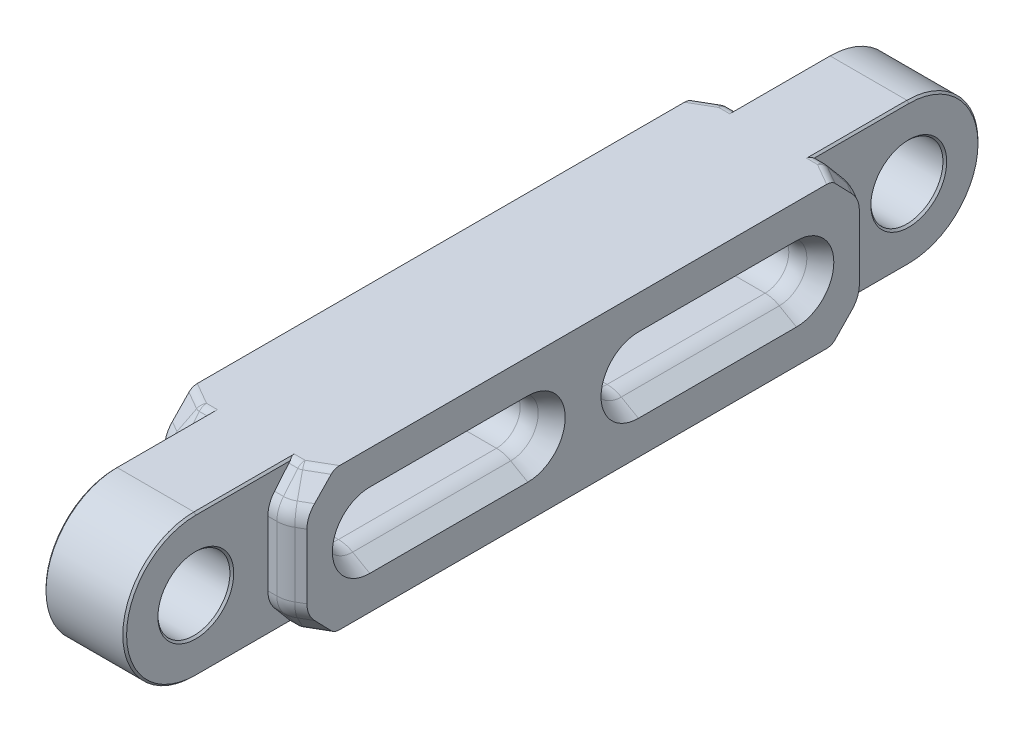
from build123d import *
from OCP.BRepFilletAPI import BRepFilletAPI_MakeChamfer

# Parameters (mm, degrees)
BOSS_EXTRUDE1_DEPTH = 8.5
BOSS_EXTRUDE2_DEPTH = 15
CHAMFER8_SIZE       = 3
CHAMFER8_SIZE2      = 1.732050808
FILLET6_R           = 6
CHAMFER9_SIZE       = 6
CHAMFER9_SIZE2      = 5.034597787
FILLET7_R           = 6
CHAMFER10_SIZE      = 5
CHAMFER10_SIZE2     = 2.886751346
FILLET8_R           = 6
FILLET9_R           = 2
CHAMFER11_SIZE      = 0.4


with BuildPart() as part:
    # Sketch1 → Boss-Extrude1 (new body)
    with BuildSketch(Plane.YZ):
        with BuildLine():
            ThreePointArc((0, -7.6), (-7.6, 0), (0, 7.6))
            Line((0, 7.6), (0, 15))
            ThreePointArc((0, 15), (-10.606601718, 10.606601718), (-15, 0))
            Line((-15, 0), (-15, -75.2))
            Line((-15, -75.2), (0, -75.2))
            Line((0, -75.2), (0, -68.533333333))
            ThreePointArc((0, -68.533333333), (-3.535533906, -67.068867239), (-5, -63.533333333))
            Line((-5, -63.533333333), (-5, -30.2))
            ThreePointArc((-5, -30.2), (-3.535533906, -26.664466094), (0, -25.2))
            Line((0, -25.2), (0, -7.6))
        make_face()
    extrude(amount=BOSS_EXTRUDE1_DEPTH)

    # Sketch1<4> → Boss-Extrude2 (add)
    with BuildSketch(Plane.YZ):
        with BuildLine():
            Line((0, -15.2), (-15, -15.2))
            Line((-15, -15.2), (-15, -75.2))
            Line((-15, -75.2), (0, -75.2))
            Line((0, -75.2), (0, -68.533333333))
            ThreePointArc((0, -68.533333333), (-3.535533906, -67.068867239), (-5, -63.533333333))
            Line((-5, -63.533333333), (-5, -30.2))
            ThreePointArc((-5, -30.2), (-3.535533906, -26.664466094), (0, -25.2))
            Line((0, -25.2), (0, -15.2))
        make_face()
    extrude(amount=BOSS_EXTRUDE2_DEPTH)

    # Chamfer8
    chamfer8_edges = [part.edges().sort_by_distance(p)[0] for p in [
        (15, -7.5, -15.2),
    ]]
    chamfer8_side = [part.faces().sort_by_distance(p)[0] for p in [
        (11.75, -7.5, -15.2),
    ]]
    chamfer(chamfer8_edges, length=CHAMFER8_SIZE, length2=CHAMFER8_SIZE2, reference=chamfer8_side[0])

    # Fillet6
    fillet6_edges = [part.edges().sort_by_distance(p)[0] for p in [
        (12, -7.5, -15.2),
    ]]
    fillet(fillet6_edges, radius=FILLET6_R)

    # Chamfer9: one chamfer whose edges measure the first distance from different faces: ONE call of the kernel's chamfer builder (chamfer() names one face for all edges)
    chamfer9_edges_1 = [part.edges().sort_by_distance(p)[0] for p in [
        (14.196152423, -15, -16.467949192),
    ]]
    chamfer9_side_1 = [part.faces().sort_by_distance(p)[0] for p in [
        (14.196152423, -7.5, -16.467949192),
    ]]
    chamfer9_edges_2 = [part.edges().sort_by_distance(p)[0] for p in [
        (11.945219116, -15, -15.404445042),
    ]]
    chamfer9_side_2 = [part.faces().sort_by_distance(p)[0] for p in [
        (11.945219116, -7.5, -15.404445042),
    ]]
    chamfer9_edges_3 = [part.edges().sort_by_distance(p)[0] for p in [
        (9.446152423, -15, -15.2),
    ]]
    chamfer9_side_3 = [part.faces().sort_by_distance(p)[0] for p in [
        (9.446152423, -7.5, -15.2),
    ]]
    chamfer9 = BRepFilletAPI_MakeChamfer(part.part.solid().wrapped)
    for e in chamfer9_edges_1:
        chamfer9.Add(CHAMFER9_SIZE, CHAMFER9_SIZE2, e.wrapped, chamfer9_side_1[0].wrapped)  # the first distance lies on this face
    for e in chamfer9_edges_2:
        chamfer9.Add(CHAMFER9_SIZE, CHAMFER9_SIZE2, e.wrapped, chamfer9_side_2[0].wrapped)  # the first distance lies on this face
    for e in chamfer9_edges_3:
        chamfer9.Add(CHAMFER9_SIZE, CHAMFER9_SIZE2, e.wrapped, chamfer9_side_3[0].wrapped)  # the first distance lies on this face
    add(Compound.cast(chamfer9.Shape()), mode=Mode.REPLACE)

    # Fillet7
    fillet7_edges = [part.edges().sort_by_distance(p)[0] for p in [
        (14.196152423, -9, -16.467949192),
        (11.945219116, -9, -15.404445042),
        (9.446152423, -9, -15.2),
    ]]
    fillet(fillet7_edges, radius=FILLET7_R)

    # Chamfer10: one chamfer whose edges measure the first distance from different faces: ONE call of the kernel's chamfer builder (chamfer() names one face for all edges)
    chamfer10_edges_1 = [part.edges().sort_by_distance(p)[0] for p in [
        (15, -3.535533906, -67.068867239),
    ]]
    chamfer10_side_1 = [part.faces().sort_by_distance(p)[0] for p in [
        (7.5, -3.535533906, -67.068867239),
    ]]
    chamfer10_edges_2 = [part.edges().sort_by_distance(p)[0] for p in [
        (15, -5, -46.866666667),
    ]]
    chamfer10_side_2 = [part.faces().sort_by_distance(p)[0] for p in [
        (7.5, -5, -46.866666667),
    ]]
    chamfer10_edges_3 = [part.edges().sort_by_distance(p)[0] for p in [
        (15, -3.535533906, -26.664466094),
    ]]
    chamfer10_side_3 = [part.faces().sort_by_distance(p)[0] for p in [
        (7.5, -3.535533906, -26.664466094),
    ]]
    chamfer10 = BRepFilletAPI_MakeChamfer(part.part.solid().wrapped)
    for e in chamfer10_edges_1:
        chamfer10.Add(CHAMFER10_SIZE, CHAMFER10_SIZE2, e.wrapped, chamfer10_side_1[0].wrapped)  # the first distance lies on this face
    for e in chamfer10_edges_2:
        chamfer10.Add(CHAMFER10_SIZE, CHAMFER10_SIZE2, e.wrapped, chamfer10_side_2[0].wrapped)  # the first distance lies on this face
    for e in chamfer10_edges_3:
        chamfer10.Add(CHAMFER10_SIZE, CHAMFER10_SIZE2, e.wrapped, chamfer10_side_3[0].wrapped)  # the first distance lies on this face
    add(Compound.cast(chamfer10.Shape()), mode=Mode.REPLACE)

    # Fillet8
    fillet8_edges = [part.edges().sort_by_distance(p)[0] for p in [
        (10, -3.535533906, -67.068867239),
        (10, -5, -46.866666667),
        (10, -3.535533906, -26.664466094),
    ]]
    fillet(fillet8_edges, radius=FILLET8_R)

    # Fillet9
    fillet9_edges = [part.edges().sort_by_distance(p)[0] for p in [
        (9.446152423, -15, -20.234597787),
        (10.642169324, -15, -20.26749307),
        (12.937502976, -15, -21.554720371),
    ]]
    fillet(fillet9_edges, radius=FILLET9_R)

    # Chamfer11
    chamfer11_edges = [part.edges().sort_by_distance(p)[0] for p in [
        (8.5, -7.6, 0),
        (8.5, -15, -10.583606552),
        (8.5, -10.606601718, 10.606601718),
    ]]
    chamfer(chamfer11_edges, length=CHAMFER11_SIZE)

    # Mirror1: part across plane


with BuildPart() as part_1:
    add(part.part)
    add(part.part.mirror(Plane(origin=(8.5, 0, 0), x_dir=(0, 0, 1), z_dir=(0, 1, 0))))

    # Mirror2: part across plane


with BuildPart() as part_2:
    add(part_1.part)
    add(part_1.part.mirror(Plane(origin=(8.5, 0, -75.2), x_dir=(1, 0, 0), z_dir=(0, 0, 1))))

    # Mirror3: part across plane


with BuildPart() as part_3:
    add(part_2.part)
    add(part_2.part.mirror(Plane(origin=(0, 0, 0), x_dir=(0, 0, 1), z_dir=(1, 0, 0))))


solid = part_3.part
